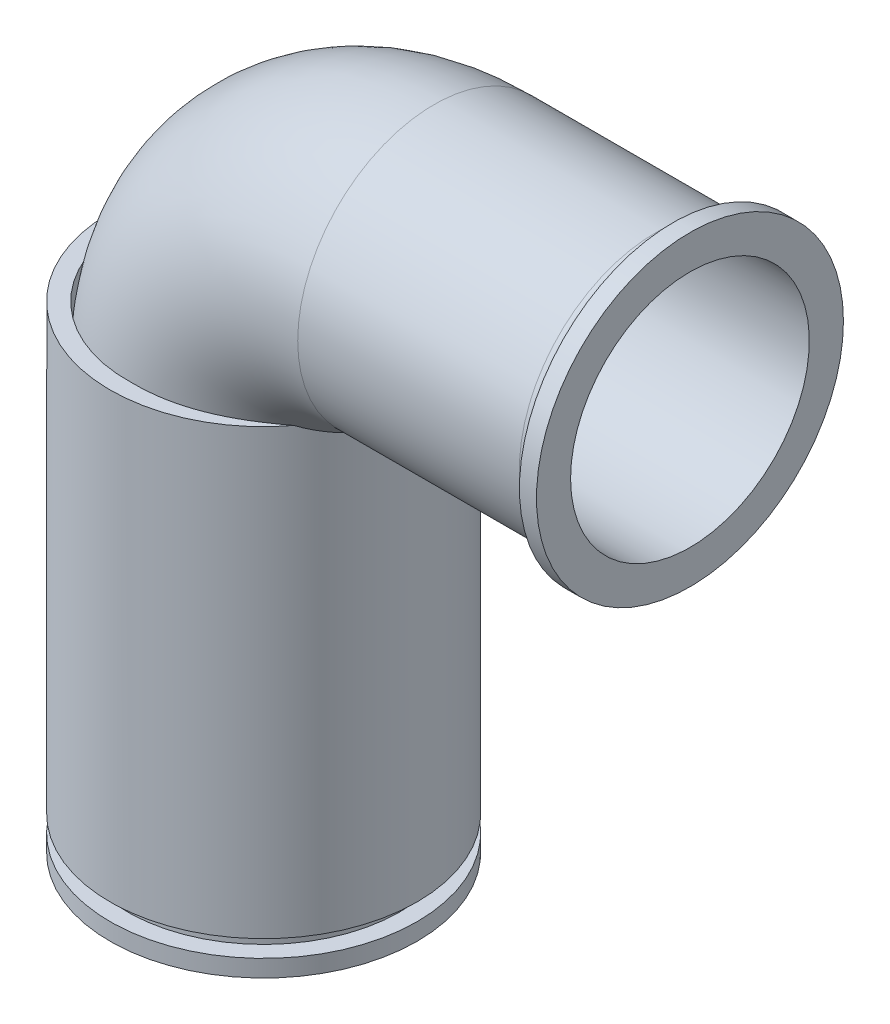
from build123d import *

# Parameters (mm, degrees)
SWEEP_THIN6_PROFILE_R   = 8
SWEEP_THIN6_PROFILE_R_2 = 7
BOSS_EXTRUDE4_START     = -28
SKETCH82_R              = 9
SKETCH82_R_2            = 8
BOSS_EXTRUDE4_DEPTH     = 28
CUT_EXTRUDE4_START      = -2
SKETCH82_2_R            = 9
SKETCH82_2_R_2          = 8
CUT_EXTRUDE4_DEPTH      = 1
SKETCH83_R              = 9
SKETCH83_R_2            = 8
BOSS_EXTRUDE5_DEPTH     = 1
FILLET3_R               = 1


with BuildPart() as part:
    # Sweep-Thin6: sweep along a path in Sketch1
    with BuildLine(Plane.XY) as sweep_thin6_path:
        Line((0, -35), (0, -10))
        ThreePointArc((0, -10), (2.928932188, -2.928932188), (10, 0))
        Line((10, 0), (25, 0))
    # Sweep-Thin6 profile (on start of the path) → Sweep-Thin6 (sweep)
    with BuildSketch(Plane(origin=(0, -35, 0), x_dir=(1, 0, 0), z_dir=(0, 1, 0))):
        Circle(SWEEP_THIN6_PROFILE_R)
        Circle(SWEEP_THIN6_PROFILE_R_2, mode=Mode.SUBTRACT)
    sweep(path=sweep_thin6_path.line)

    # Sketch82 → Boss-Extrude4 (add)
    with BuildSketch(Plane.XZ.offset(35).offset(BOSS_EXTRUDE4_START)):
        Circle(SKETCH82_R)
        Circle(SKETCH82_R_2, mode=Mode.SUBTRACT)
    extrude(amount=BOSS_EXTRUDE4_DEPTH)

    # Sketch82<2> → Cut-Extrude4 (cut)
    with BuildSketch(Plane.XZ.offset(35).offset(CUT_EXTRUDE4_START)):
        Circle(SKETCH82_2_R)
        Circle(SKETCH82_2_R_2, mode=Mode.SUBTRACT)
    extrude(amount=CUT_EXTRUDE4_DEPTH, mode=Mode.SUBTRACT)

    # Sketch83 → Boss-Extrude5 (add)
    with BuildSketch(Plane(origin=(25, 0, 0), x_dir=(0, 0, -1), z_dir=(1, 0, 0))):
        Circle(SKETCH83_R)
        Circle(SKETCH83_R_2, mode=Mode.SUBTRACT)
    extrude(amount=-BOSS_EXTRUDE5_DEPTH)

    # Fillet3
    fillet3_edges = [part.edges().sort_by_distance(p)[0] for p in [
        (24, 8, 0),
    ]]
    fillet(fillet3_edges, radius=FILLET3_R - 0.0001)  # a hair under: the kernel refuses the full size


solid = part.part
